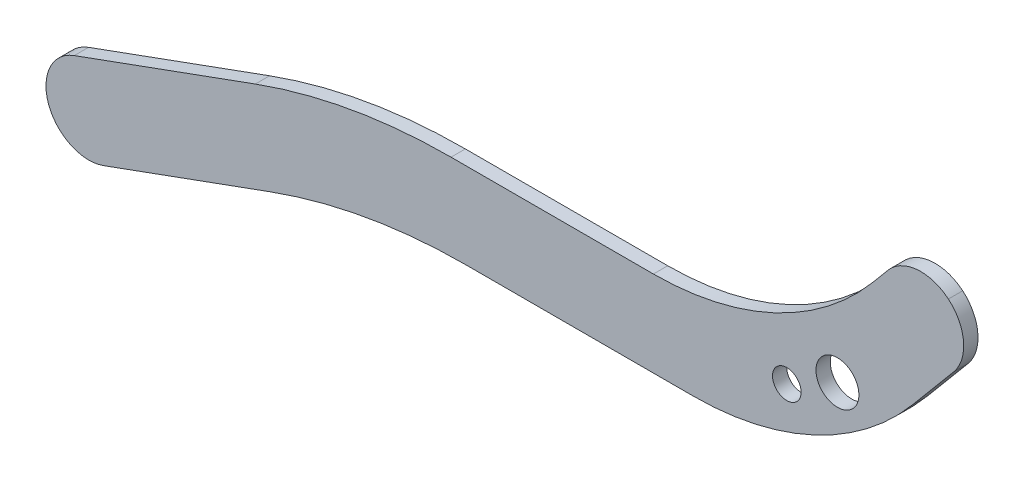
from build123d import *

# Parameters (mm, degrees)
SKETCH_2_R      = 5
SKETCH_2_R_2    = 7.5
EXTRUDE_1_DEPTH = 5
FILLET_1_R      = 200
FILLET_2_R      = 100
FILLET_3_R      = 15


with BuildPart() as part:
    # 草图2 → 凸台-拉伸1 (new body)
    with BuildSketch(Plane.XY):
        with BuildLine():
            Line((-152.644904711, 15), (-249.099564228, -20.106625021))
            ThreePointArc((-249.099564228, -20.106625021), (-258.06465139, -39.332316482), (-238.838959929, -48.297403644))
            Line((-238.838959929, -48.297403644), (-147.355095289, -15))
            Line((-147.355095289, -15), (13.989229745, -15))
            Line((13.989229745, -15), (67.976465972, 49.339482728))
            Line((67.976465972, 49.339482728), (44.995132678, 68.623111018))
            Line((44.995132678, 68.623111018), (0, 15))
            Line((0, 15), (-152.644904711, 15))
        make_face()
        with Locations((0, 5)):
            Circle(SKETCH_2_R, mode=Mode.SUBTRACT)
        with Locations((17.699325905, 14.313101658)):
            Circle(SKETCH_2_R_2, mode=Mode.SUBTRACT)
    extrude(amount=EXTRUDE_1_DEPTH)

    # 圆角1
    fillet_1_edges = [part.edges().sort_by_distance(p)[0] for p in [
        (-152.644904711, 15, 2.5),
        (-147.355095289, -15, 2.5),
    ]]
    fillet(fillet_1_edges, radius=FILLET_1_R)

    # 圆角2
    fillet_2_edges = [part.edges().sort_by_distance(p)[0] for p in [
        (0, 15, 2.5),
        (13.989229745, -15, 2.5),
    ]]
    fillet(fillet_2_edges, radius=FILLET_2_R)

    # 圆角3
    fillet_3_edges = [part.edges().sort_by_distance(p)[0] for p in [
        (44.995132678, 68.623111018, 2.5),
        (67.976465972, 49.339482728, 2.5),
    ]]
    fillet(fillet_3_edges, radius=FILLET_3_R - 0.0001)  # a hair under: the kernel refuses the full size


solid = part.part
